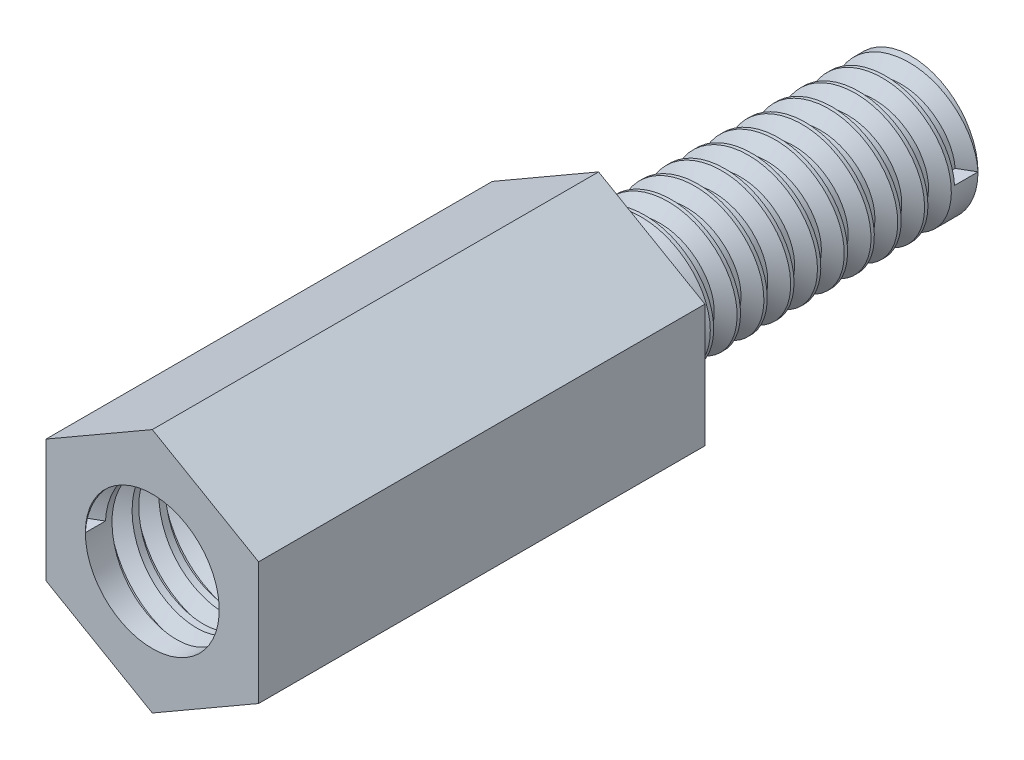
from build123d import *
from build123d.topology import SkipClean

# Parameters (mm, degrees)
BOSS_EXTRUDE1_DEPTH = 10
SKETCH2_R           = 1.5
CUT_EXTRUDE1_DEPTH  = 7
SKETCH3_R           = 1.5
BOSS_EXTRUDE2_DEPTH = 7
THREAD1_PITCH       = 0.6
THREAD2_PITCH       = 0.6


with BuildPart() as part:
    # Sketch1 → Boss-Extrude1 (new body)
    with BuildSketch(Plane.XY):
        Polygon((-2.38156986, -1.375), (0, -2.75), (2.38156986, -1.375), (2.38156986, 1.375), (0, 2.75), (-2.38156986, 1.375), align=None)
    extrude(amount=BOSS_EXTRUDE1_DEPTH)

    # Sketch2 → Cut-Extrude1 (cut)
    with BuildSketch(Plane.XY.offset(10)):
        Circle(SKETCH2_R)
    extrude(amount=-CUT_EXTRUDE1_DEPTH, mode=Mode.SUBTRACT)

    # Sketch3 → Boss-Extrude2 (add)
    with BuildSketch(Plane(origin=(0, 0, 0), x_dir=(-1, 0, 0), z_dir=(0, 0, -1))):
        with Locations(Location((0, 0, 0), (0, 0, 180))):
            Circle(SKETCH3_R)
    extrude(amount=BOSS_EXTRUDE2_DEPTH)

    # Thread1: the profile of Thread Profile1 profile screwed along a right-hand helix of 11.666667 turns, 6 arcs to a turn; built about Z, then put on its axis
    thread1_z = Axis((0, 0, 0), (0, 0, 1))
    thread1_corners = [(1.5003, 0, -0.000173205), (1.5003, 0, 0.525173203), (1.175240475, 0, 0.337499999), (1.175240475, 0, 0.187499999)]
    with BuildLine(mode=Mode.PRIVATE) as thread1_profile:
        Line(thread1_corners[0], thread1_corners[1])
        Line(thread1_corners[1], thread1_corners[2])
        Line(thread1_corners[2], thread1_corners[3])
        Line(thread1_corners[3], thread1_corners[0])
    thread1_cap = Face(thread1_profile.wire())
    thread1_turn_angles = [0, 30, 60, 90, 120, 150, 180, 210, 240, 270, 300, 330, 360]
    thread1_turn_weights = [1, 0.8660254037844387, 1, 0.8660254037844387, 1, 0.8660254037844387, 1, 0.8660254037844387, 1, 0.8660254037844387, 1, 0.8660254037844387, 1]
    thread1_turn_rails = [Edge.make_bspline([Vector(p[0], p[1], 0).rotate(thread1_z, thread1_turn_angles[k]) / thread1_turn_weights[k] + Vector(0, 0, p[2] + THREAD1_PITCH * thread1_turn_angles[k] / 360) for k in range(13)], [0, 0, 0, 1, 1, 2, 2, 3, 3, 4, 4, 5, 5, 6, 6, 6], 2, thread1_turn_weights) for p in thread1_corners]
    thread1_turn_sides = [Face.make_surface_from_curves(thread1_turn_rails[p[0]], thread1_turn_rails[p[1]]) for p in [(0, 1), (1, 2), (2, 3), (3, 0)]]
    thread1_last_angles = [3960, 3990, 4020, 4050, 4080, 4110, 4140, 4170, 4200]
    thread1_last_weights = [1, 0.8660254037844387, 1, 0.8660254037844387, 1, 0.8660254037844387, 1, 0.8660254037844387, 1]
    thread1_last_rails = [Edge.make_bspline([Vector(p[0], p[1], 0).rotate(thread1_z, thread1_last_angles[k]) / thread1_last_weights[k] + Vector(0, 0, p[2] + THREAD1_PITCH * thread1_last_angles[k] / 360) for k in range(9)], [0, 0, 0, 1, 1, 2, 2, 3, 3, 4, 4, 4], 2, thread1_last_weights) for p in thread1_corners]
    thread1_last_sides = [Face.make_surface_from_curves(thread1_last_rails[p[0]], thread1_last_rails[p[1]]) for p in [(0, 1), (1, 2), (2, 3), (3, 0)]]
    thread1 = Plane(origin=(0, 0, -7), x_dir=(1, 0, 0), z_dir=(0, 0, 1)) * Solid(Shell([*[p.moved(Location((0, 0, THREAD1_PITCH * i))) for i in range(11) for p in thread1_turn_sides], *thread1_last_sides, thread1_cap, thread1_cap.rotate(thread1_z, 4200).moved(Location((0, 0, THREAD1_PITCH * 4200 / 360)))]))
    add(thread1, mode=Mode.SUBTRACT)

    # Thread2: the profile of Thread Profile2 profile screwed along a right-hand helix of 11.666667 turns, 6 arcs to a turn; built about Z, then put on its axis
    with SkipClean():  # the faces are left unmerged after this step: merging them gives an invalid solid
        thread2_z = Axis((0, 0, 0), (0, 0, 1))
        thread2_corners = [(1.4997, 0, -0.000173205), (1.824759525, 0, 0.187499999), (1.824759525, 0, 0.262499999), (1.4997, 0, 0.450173203)]
        with BuildLine(mode=Mode.PRIVATE) as thread2_profile:
            Line(thread2_corners[0], thread2_corners[1])
            Line(thread2_corners[1], thread2_corners[2])
            Line(thread2_corners[2], thread2_corners[3])
            Line(thread2_corners[3], thread2_corners[0])
        thread2_cap = Face(thread2_profile.wire())
        thread2_turn_angles = [0, 30, 60, 90, 120, 150, 180, 210, 240, 270, 300, 330, 360]
        thread2_turn_weights = [1, 0.8660254037844387, 1, 0.8660254037844387, 1, 0.8660254037844387, 1, 0.8660254037844387, 1, 0.8660254037844387, 1, 0.8660254037844387, 1]
        thread2_turn_rails = [Edge.make_bspline([Vector(p[0], p[1], 0).rotate(thread2_z, thread2_turn_angles[k]) / thread2_turn_weights[k] + Vector(0, 0, p[2] + THREAD2_PITCH * thread2_turn_angles[k] / 360) for k in range(13)], [0, 0, 0, 1, 1, 2, 2, 3, 3, 4, 4, 5, 5, 6, 6, 6], 2, thread2_turn_weights) for p in thread2_corners]
        thread2_turn_sides = [Face.make_surface_from_curves(thread2_turn_rails[p[0]], thread2_turn_rails[p[1]]) for p in [(0, 1), (1, 2), (2, 3), (3, 0)]]
        thread2_last_angles = [3960, 3990, 4020, 4050, 4080, 4110, 4140, 4170, 4200]
        thread2_last_weights = [1, 0.8660254037844387, 1, 0.8660254037844387, 1, 0.8660254037844387, 1, 0.8660254037844387, 1]
        thread2_last_rails = [Edge.make_bspline([Vector(p[0], p[1], 0).rotate(thread2_z, thread2_last_angles[k]) / thread2_last_weights[k] + Vector(0, 0, p[2] + THREAD2_PITCH * thread2_last_angles[k] / 360) for k in range(9)], [0, 0, 0, 1, 1, 2, 2, 3, 3, 4, 4, 4], 2, thread2_last_weights) for p in thread2_corners]
        thread2_last_sides = [Face.make_surface_from_curves(thread2_last_rails[p[0]], thread2_last_rails[p[1]]) for p in [(0, 1), (1, 2), (2, 3), (3, 0)]]
        thread2 = Plane(origin=(0, 0, 10), x_dir=(-1, 0, 0), z_dir=(0, 0, -1)) * Solid(Shell([*[p.moved(Location((0, 0, THREAD2_PITCH * i))) for i in range(11) for p in thread2_turn_sides], *thread2_last_sides, thread2_cap, thread2_cap.rotate(thread2_z, 4200).moved(Location((0, 0, THREAD2_PITCH * 4200 / 360)))]))
        add(thread2, mode=Mode.SUBTRACT)


solid = part.part
